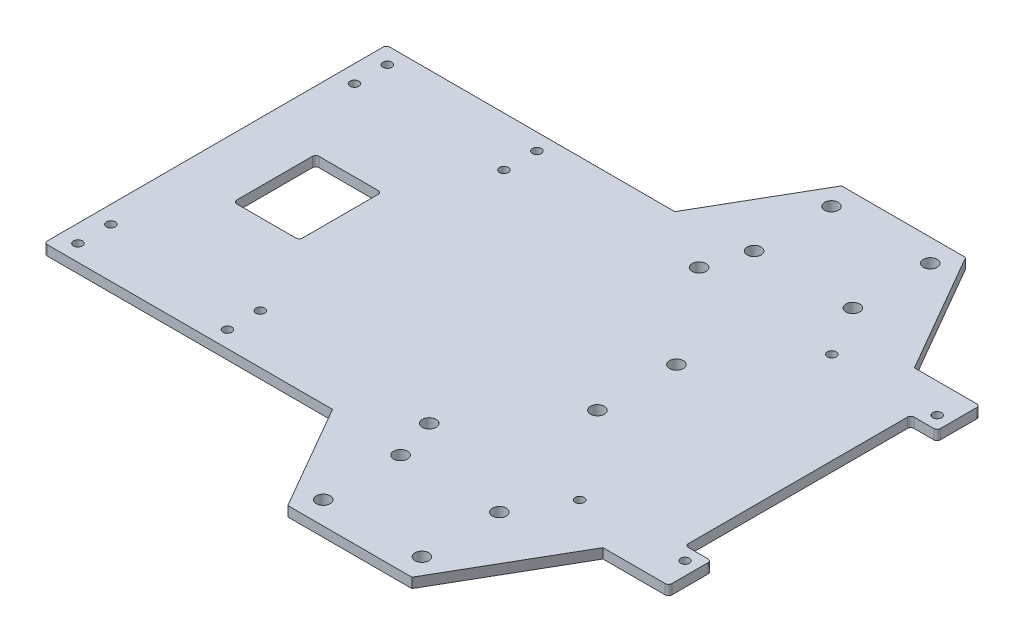
from build123d import *

# Parameters (mm, degrees)
BOSS_EXTRUDE1_DEPTH              = 3
SKETCH2_R                        = 1.35
MOTOR_CLEVIS_HOLES_DEPTH         = 204.240768548
SKETCH3_R                        = 1.35
SERVO_CLEVIS_HOLES_DEPTH         = 204.240768548
SKETCH4_R                        = 2.1
BUCKET_HOLE_DEPTH                = 204.240768548
SKETCH5_R                        = 2.1
CASTER_HOLES_DEPTH               = 204.240768548
SKETCH6_W                        = 8
SKETCH6_H                        = 68.6
FRONT_NOTCH_DEPTH                = 204.240768548
FILLET2_R                        = 1
SKETCH9_R                        = 2.1
COLOR_SENSOR_BRACKET_HOLES_DEPTH = 204.240768548
SKETCH10_W                       = 20
SKETCH10_H                       = 25
MOTOR_ROUTING_POCKET_DEPTH       = 204.240768548
FILLET3_R                        = 1


with BuildPart() as part:
    # Sketch1 → Boss-Extrude1 (new body)
    with BuildSketch(Plane(origin=(0, 0, 0), x_dir=(1, 0, 0), z_dir=(0, 1, 0))):
        Polygon((0, 52), (0, -52), (87.617056359, -52), (106.15, -84.1), (143.85, -84.1), (165.096489906, -47.3), (185, -47.3), (185, 47.3), (165.096489906, 47.3), (143.85, 84.1), (106.15, 84.1), (87.617056359, 52), align=None)
    extrude(amount=BOSS_EXTRUDE1_DEPTH)

    # Sketch2 → Motor Clevis Holes (cut, through all)
    with BuildSketch(Plane(origin=(0, 3, 0), x_dir=(1, 0, 0), z_dir=(0, 1, 0))):
        with Locations((5.3, 47)):
            Circle(SKETCH2_R)
        with Locations((5.3, 37)):
            Circle(SKETCH2_R)
        with Locations((50.7, 47)):
            Circle(SKETCH2_R)
        with Locations((50.7, 37)):
            Circle(SKETCH2_R)
    motor_clevis_holes = extrude(amount=-MOTOR_CLEVIS_HOLES_DEPTH, mode=Mode.SUBTRACT)

    # Motor Clevis Holes Mirror: Motor Clevis Holes across plane
    add(motor_clevis_holes.mirror(Plane.XY), mode=Mode.SUBTRACT)

    # Sketch3 → Servo Clevis Holes (cut, through all)
    with BuildSketch(Plane(origin=(0, 3, 0), x_dir=(1, 0, 0), z_dir=(0, 1, 0))):
        with Locations((181, -38.3)):
            Circle(SKETCH3_R)
        with Locations((149, -38.3)):
            Circle(SKETCH3_R)
    servo_clevis_holes = extrude(amount=-SERVO_CLEVIS_HOLES_DEPTH, mode=Mode.SUBTRACT)

    # Servo Clevis Holes Mirror: Servo Clevis Holes across plane
    add(servo_clevis_holes.mirror(Plane.XY), mode=Mode.SUBTRACT)

    # Sketch4 → Bucket Hole (cut, through all)
    with BuildSketch(Plane(origin=(0, 3, 0), x_dir=(1, 0, 0), z_dir=(0, 1, 0))):
        with Locations((128.1, -12)):
            Circle(SKETCH4_R)
    bucket_hole = extrude(amount=-BUCKET_HOLE_DEPTH, mode=Mode.SUBTRACT)

    # Bucket Hole Mirror: Bucket Hole across plane
    add(bucket_hole.mirror(Plane.XY), mode=Mode.SUBTRACT)

    # Sketch5 → Caster Holes (cut, through all)
    with BuildSketch(Plane(origin=(0, 3, 0), x_dir=(1, 0, 0), z_dir=(0, 1, 0))):
        with Locations((110, -53.7)):
            Circle(SKETCH5_R)
        with Locations((110, -77.2)):
            Circle(SKETCH5_R)
        with Locations((140, -77.2)):
            Circle(SKETCH5_R)
        with Locations((140, -53.7)):
            Circle(SKETCH5_R)
    caster_holes = extrude(amount=-CASTER_HOLES_DEPTH, mode=Mode.SUBTRACT)

    # Caster Holes Mirror: Caster Holes across plane
    add(caster_holes.mirror(Plane.XY), mode=Mode.SUBTRACT)

    # Sketch6 → Front Notch (cut, through all)
    with BuildSketch(Plane(origin=(0, 3, 0), x_dir=(1, 0, 0), z_dir=(0, 1, 0))):
        with Locations((181, 0)):
            Rectangle(SKETCH6_W, SKETCH6_H)
    extrude(amount=-FRONT_NOTCH_DEPTH, mode=Mode.SUBTRACT)

    # Fillet2
    fillet2_edges = [part.edges().sort_by_distance(p)[0] for p in [
        (185, 1.5, 47.3),
        (185, 1.5, 34.3),
        (177, 1.5, 34.3),
        (177, 1.5, -34.3),
        (185, 1.5, -34.3),
        (185, 1.5, -47.3),
        (0, 1.5, -52),
        (0, 1.5, 52),
    ]]
    fillet(fillet2_edges, radius=FILLET2_R)

    # Sketch9 → Color Sensor Bracket Holes (cut, through all)
    with BuildSketch(Plane(origin=(0, 3, 0), x_dir=(1, 0, 0), z_dir=(0, 1, 0))):
        with Locations((106, 41)):
            Circle(SKETCH9_R)
        with Locations((106, -41)):
            Circle(SKETCH9_R)
    extrude(amount=-COLOR_SENSOR_BRACKET_HOLES_DEPTH, mode=Mode.SUBTRACT)

    # Sketch10 → Motor Routing Pocket (cut, through all)
    with BuildSketch(Plane(origin=(0, 3, 0), x_dir=(1, 0, 0), z_dir=(0, 1, 0))):
        with Locations((28, 0)):
            Rectangle(SKETCH10_W, SKETCH10_H)
    extrude(amount=-MOTOR_ROUTING_POCKET_DEPTH, mode=Mode.SUBTRACT)

    # Fillet3
    fillet3_edges = [part.edges().sort_by_distance(p)[0] for p in [
        (18, 1.5, 12.5),
        (38, 1.5, 12.5),
        (38, 1.5, -12.5),
        (18, 1.5, -12.5),
    ]]
    fillet(fillet3_edges, radius=FILLET3_R)


solid = part.part
